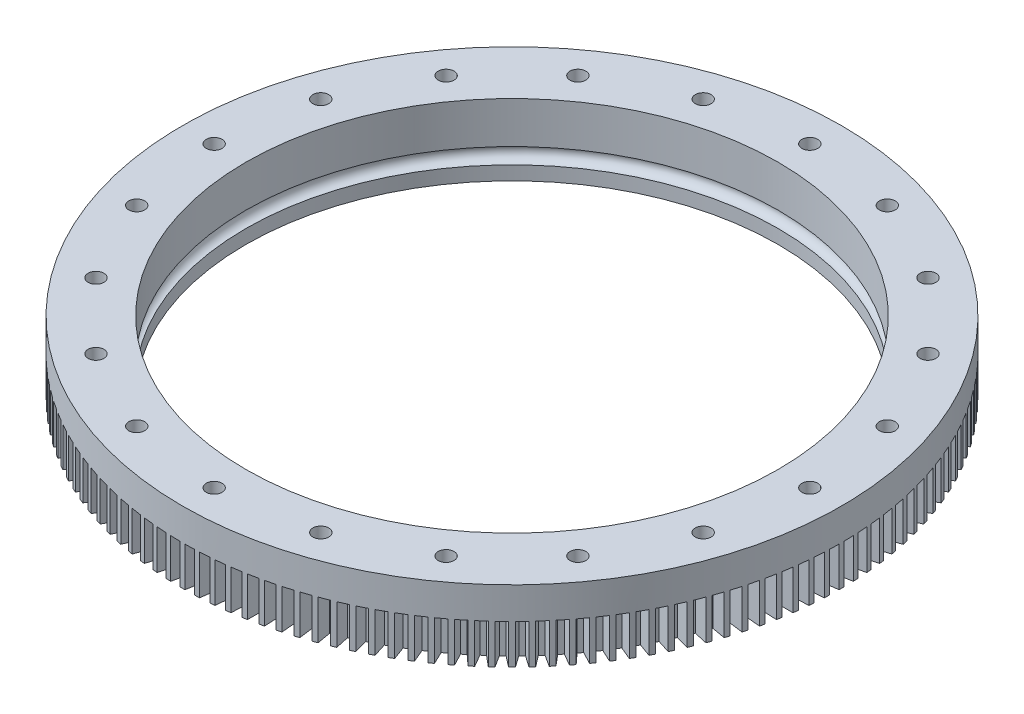
from build123d import *

# Parameters (mm, degrees)
ESQUISSE2_R                  = 10
ENL_V_MAT_EXTRU_1_DEPTH      = 30
R_P_TITION_CIRCULAIRE1_COUNT = 20
ENL_V_MAT_EXTRU_2_DEPTH      = 50
R_P_TITION_CIRCULAIRE2_COUNT = 144


with BuildPart() as part:
    # Esquisse1 → Révolution1 (revolve)
    with BuildSketch(Plane.XY, mode=Mode.PRIVATE) as r_volution1_sk:
        with BuildLine():
            Line((0, 37.5), (0, 90))
            Line((0, 90), (80, 90))
            Line((80, 90), (80, 0))
            Line((80, 0), (0, 0))
            Line((0, 0), (0, 17.5))
            ThreePointArc((0, 17.5), (10, 27.5), (0, 37.5))
        make_face()
    revolve(r_volution1_sk.sketch.rotate(Axis((-336, 0, 0), (0, 1, 0)), 90), axis=Axis((-336, 0, 0), (0, 1, 0)))

    # Esquisse2 → Enlèv. mat.-Extru.1 (cut)
    with BuildSketch(Plane(origin=(0, 90, 0), x_dir=(1, 0, 0), z_dir=(0, 1, 0))):
        with Locations(Location((40, 0, 0), (0, 0, 270))):
            Circle(ESQUISSE2_R)
    enl_v_mat_extru_1 = extrude(amount=-ENL_V_MAT_EXTRU_1_DEPTH, mode=Mode.SUBTRACT)

    # Répétition circulaire1: Enlèv. mat.-Extru.1 ×20 about axis
    r_p_tition_circulaire1_axis = Axis((-336, 0, 0), (0, 1, 0))
    for i in range(1, R_P_TITION_CIRCULAIRE1_COUNT):
        add(enl_v_mat_extru_1.rotate(r_p_tition_circulaire1_axis, i * 360 / R_P_TITION_CIRCULAIRE1_COUNT), mode=Mode.SUBTRACT)

    # Esquisse3 → Enlèv. mat.-Extru.2 (cut)
    with BuildSketch(Plane.XZ):
        with BuildLine():
            Line((79.989182692, -2.999980498), (62.429735559, -6.096184794))
            Line((62.429735559, -6.096184794), (62.429735559, -12.096184794))
            Line((62.429735559, -12.096184794), (79.72419803, -15.145665144))
            ThreePointArc((79.72419803, -15.145665144), (79.901029491, -9.073790176), (79.989182692, -2.999980498))
        make_face()
    enl_v_mat_extru_2 = extrude(amount=-ENL_V_MAT_EXTRU_2_DEPTH, mode=Mode.SUBTRACT)

    # Répétition circulaire2: Enlèv. mat.-Extru.2 ×144 about axis
    r_p_tition_circulaire2_axis = Axis((-336, 0, 0), (0, 1, 0))
    for i in range(1, R_P_TITION_CIRCULAIRE2_COUNT):
        add(enl_v_mat_extru_2.rotate(r_p_tition_circulaire2_axis, i * 360 / R_P_TITION_CIRCULAIRE2_COUNT), mode=Mode.SUBTRACT)


solid = part.part
